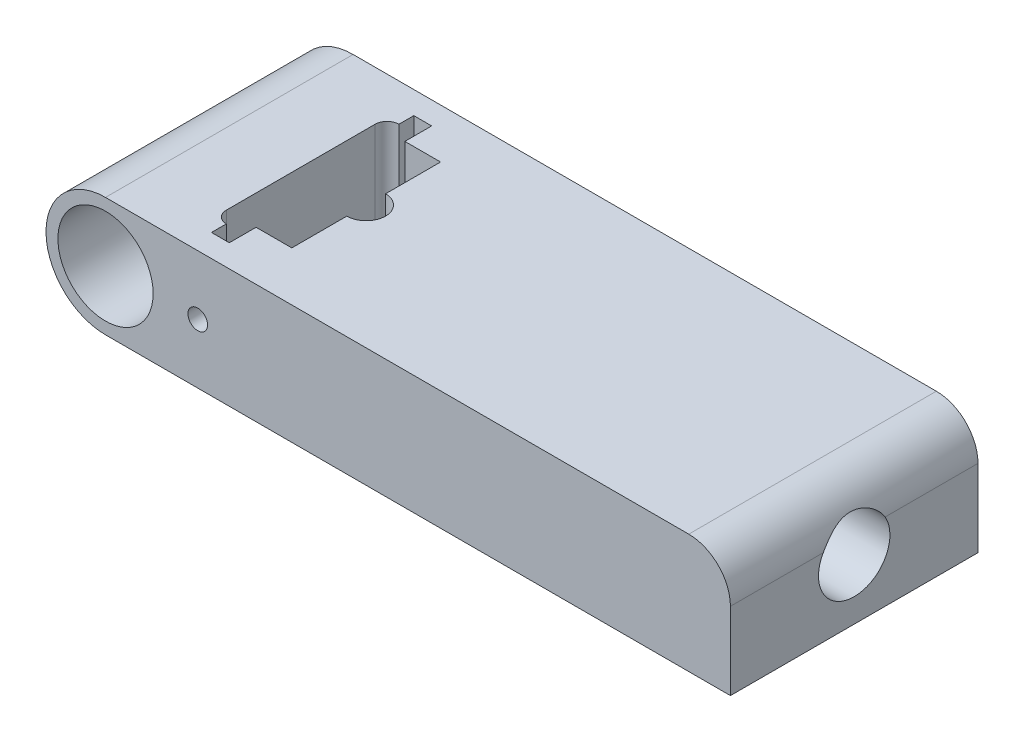
from build123d import *

# Parameters (mm, degrees)
ESQUISSE1_R                         = 8
BOSS_EXTRU_1_DEPTH                  = 20.8
DIAM_TRE_DU_PER_AGE_12_0_12_1_D     = 12
DIAM_TRE_DU_PER_AGE_12_0_12_1_DEPTH = 88
DIAM_TRE_DU_PER_AGE_12_0_12_1_TIP   = 3.605163714
CONG_1_R                            = 7
ENL_V_MAT_EXTRU_1_DEPTH             = 109.892791429
ESQUISSE6_R                         = 3.25
ENL_V_MAT_EXTRU_2_DEPTH             = 10
TROU_TARAUD_M41_D                   = 3.3


with BuildPart() as part:
    # Esquisse1 → Boss.-Extru.1 (new, symmetric)
    with BuildSketch(Plane.XY):
        with BuildLine():
            Line((0, -10), (105, -10))
            Line((105, -10), (105, 10))
            Line((105, 10), (0, 10))
            ThreePointArc((0, 10), (-10, 0), (0, -10))
        make_face()
        Circle(ESQUISSE1_R, mode=Mode.SUBTRACT)
    extrude(amount=BOSS_EXTRU_1_DEPTH, both=True)

    # Diamètre du perçage Ø12.0 (12)1
    with Locations(Plane(origin=(105, 0, 0), x_dir=(0, 0, -1), z_dir=(1, 0, 0))):
        with Locations((0, 0)):
            Hole(DIAM_TRE_DU_PER_AGE_12_0_12_1_D / 2, depth=DIAM_TRE_DU_PER_AGE_12_0_12_1_DEPTH)
            with Locations((0, 0, -(DIAM_TRE_DU_PER_AGE_12_0_12_1_DEPTH + DIAM_TRE_DU_PER_AGE_12_0_12_1_TIP / 2))):  # 118° drill point
                Cone(0, DIAM_TRE_DU_PER_AGE_12_0_12_1_D / 2, DIAM_TRE_DU_PER_AGE_12_0_12_1_TIP, mode=Mode.SUBTRACT)

    # Congé1
    # the kernel refuses this fillet: 7 mm, written as the material it takes off along each edge
    with BuildSketch(Plane(origin=(105, 10, -38.3), x_dir=(0, -1, 0), z_dir=(0, 0, 1))) as cong_1_piece_1:
        with BuildLine():
            CenterArc((CONG_1_R, -CONG_1_R), CONG_1_R, 90, 90)
            Line((0, -CONG_1_R), (0, 0))
            Line((0, 0), (CONG_1_R, 0))
        make_face()
    extrude(amount=76.6, mode=Mode.SUBTRACT)

    # Esquisse5 → Enlèv. mat.-Extru.1 (cut, through all)
    with BuildSketch(Plane(origin=(0, 10, 0), x_dir=(1, 0, 0), z_dir=(0, 1, 0))):
        with BuildLine():
            Line((12, -12.5), (12, 12.5))
            ThreePointArc((12, 12.5), (12.585786438, 13.914213562), (14, 14.5))
            Line((14, 14.5), (14, 17))
            Line((14, 17), (17, 17))
            Line((17, 17), (17, 12.5))
            Line((17, 12.5), (23, 12.5))
            Line((23, 12.5), (23, -12.5))
            Line((23, -12.5), (17, -12.5))
            Line((17, -12.5), (17, -17))
            Line((17, -17), (14, -17))
            Line((14, -17), (14, -14.5))
            ThreePointArc((14, -14.5), (12.585786438, -13.914213562), (12, -12.5))
        make_face()
    extrude(amount=-ENL_V_MAT_EXTRU_1_DEPTH, mode=Mode.SUBTRACT)

    # Esquisse6 → Enlèv. mat.-Extru.2 (cut)
    with BuildSketch(Plane(origin=(0, 10, 0), x_dir=(1, 0, 0), z_dir=(0, 1, 0))):
        with Locations((23, 0)):
            Circle(ESQUISSE6_R)
    extrude(amount=-ENL_V_MAT_EXTRU_2_DEPTH, mode=Mode.SUBTRACT)

    # Trou taraudé M41 (through all)
    with Locations(Plane(origin=(0, 0, -20.8), x_dir=(-1, 0, 0), z_dir=(0, 0, -1))):
        with Locations((-15.5, 0)):
            Hole(TROU_TARAUD_M41_D / 2)


solid = part.part
